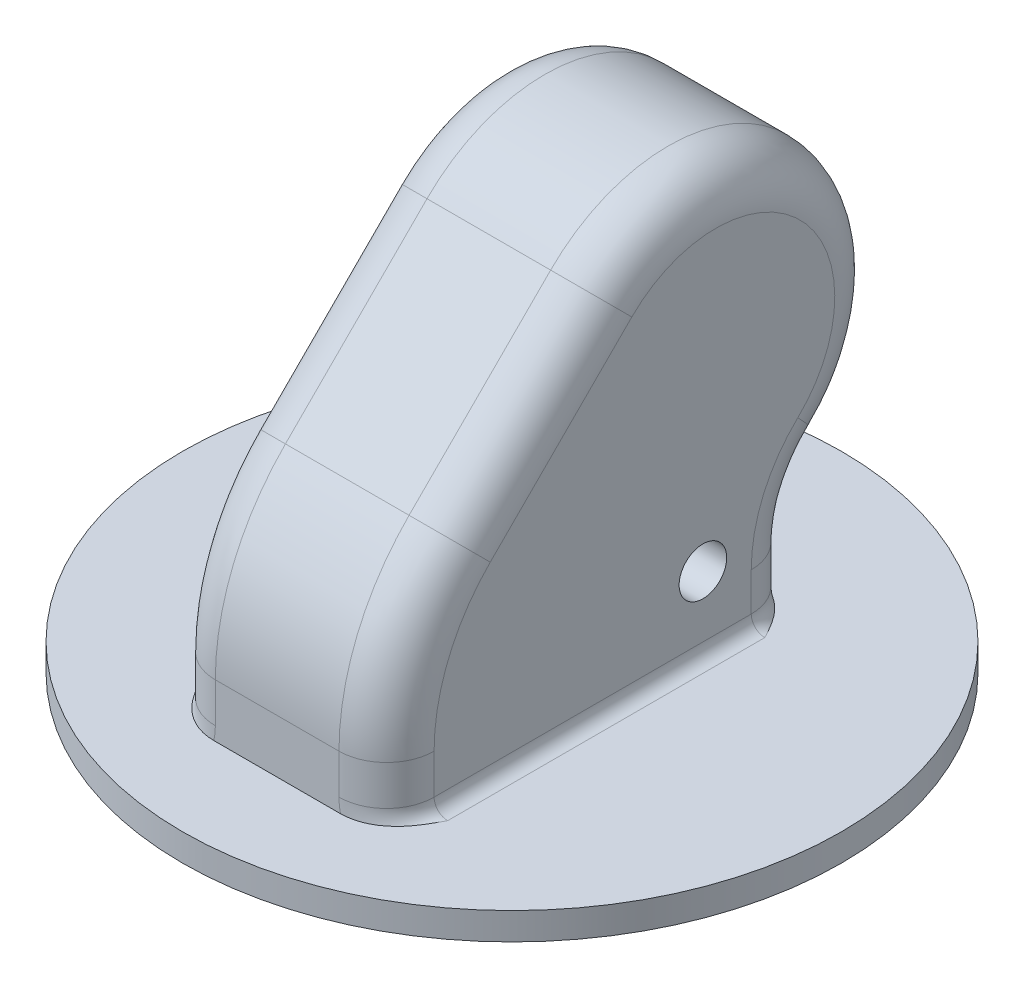
from build123d import *

# Parameters (mm, degrees)
SKETCH1_R           = 48.5
SKETCH1_R_2         = 1.5
BOSS_EXTRUDE1_DEPTH = 4
SKETCH2_R           = 3.75
CUT_EXTRUDE1_DEPTH  = 1.5
BOSS_EXTRUDE2_DEPTH = 16.1
CUT_EXTRUDE3_DEPTH  = 14.1
FILLET3_R           = 2
CUT_EXTRUDE4_DEPTH  = 10.1
CUT_EXTRUDE5_DEPTH  = 5
CUT_EXTRUDE6_REACH  = 105.546
SKETCH7_R           = 2.1
FILLET4_R           = 7
CUT_EXTRUDE7_REACH  = 96.345
CUT_EXTRUDE9_REACH  = 105.546
SKETCH10_R          = 3.5


with BuildPart() as part:
    # Sketch1 → Boss-Extrude1 (new body)
    with BuildSketch(Plane(origin=(0, 0, 0), x_dir=(1, 0, 0), z_dir=(0, 1, 0))):
        with Locations(Location((0, 0, 0), (0, 0, 270))):
            Circle(SKETCH1_R)
        with Locations(Location((0, 7.25, 0), (0, 0, 270))):
            Circle(SKETCH1_R_2, mode=Mode.SUBTRACT)
        with Locations(Location((0, -7.25, 0), (0, 0, 270))):
            Circle(SKETCH1_R_2, mode=Mode.SUBTRACT)
    extrude(amount=BOSS_EXTRUDE1_DEPTH)

    # Sketch2 → Cut-Extrude1 (cut)
    with BuildSketch(Plane.XZ):
        with Locations(Location((0, 0, 0), (0, 0, 270))):
            Circle(SKETCH2_R)
    extrude(amount=-CUT_EXTRUDE1_DEPTH, mode=Mode.SUBTRACT)

    # Sketch3 → Boss-Extrude2 (add)
    with BuildSketch(Plane(origin=(-16.1, 0, 0), x_dir=(0, 0, -1), z_dir=(1, 0, 0))):
        with BuildLine():
            Line((-34.56705163, 4), (-34.56705163, 11.86))
            ThreePointArc((-34.56705163, 11.86), (-31.885614823, 25.340493156), (-24.249528849, 36.768703429))
            Line((-24.249528849, 36.768703429), (-3.414116139, 57.604116139))
            ThreePointArc((-3.414116139, 57.604116139), (31.45553512, 57.379830331), (30.782714812, 22.515949367))
            ThreePointArc((30.782714812, 22.515949367), (27.329742948, 17.558044298), (26.11294837, 11.64))
            Line((26.11294837, 11.64), (26.11294837, 4))
            Line((26.11294837, 4), (-34.56705163, 4))
        make_face()
    extrude(amount=BOSS_EXTRUDE2_DEPTH)

    # Sketch4 → Cut-Extrude3 (cut)
    with BuildSketch(Plane(origin=(-14.1, 0, 0), x_dir=(0, 0, -1), z_dir=(1, 0, 0))):
        Polygon((13.741708053, 54.253843677), (27.883843677, 40.111708053), (-1.814641133, 10.413223243), (-15.956776757, 24.555358867), align=None)
    extrude(amount=CUT_EXTRUDE3_DEPTH, mode=Mode.SUBTRACT)

    # Fillet3
    fillet3_edges = [part.edges().sort_by_distance(p)[0] for p in [
        (-16.1, 4, 4.22705163),
    ]]
    fillet(fillet3_edges, radius=FILLET3_R)

    # Sketch5 → Cut-Extrude4 (cut)
    with BuildSketch(Plane(origin=(0, 0, 0), x_dir=(0, 0, -1), z_dir=(1, 0, 0))):
        with BuildLine():
            ThreePointArc((-1.292795796, 55.482795796), (-18.79687153, 31.790007), (-28.56705163, 4))
            Line((-28.56705163, 4), (-8.75, 4))
            Line((-8.75, 4), (-5.75, 4))
            Line((-5.75, 4), (5.75, 4))
            Line((5.75, 4), (8.75, 4))
            Line((8.75, 4), (23.11294837, 4))
            Line((23.11294837, 4), (23.11294837, 11.64))
            ThreePointArc((23.11294837, 11.64), (24.573101864, 18.741653158), (28.7166681, 24.691139241))
            ThreePointArc((28.7166681, 24.691139241), (29.307102248, 55.285973556), (-1.292795796, 55.482795796))
        make_face()
        Polygon((27.883843677, 40.111708053), (-1.814641133, 10.413223243), (-15.956776757, 24.555358867), (13.741708053, 54.253843677), align=None, mode=Mode.SUBTRACT)
    extrude(amount=-CUT_EXTRUDE4_DEPTH, mode=Mode.SUBTRACT)

    # Mirror6: part across plane


with BuildPart() as part_1:
    add(part.part)
    add(part.part.mirror(Plane(origin=(0, 11.64, -41.11294837), x_dir=(0, 0, 1), z_dir=(1, 0, 0))))

    # Sketch6 → Cut-Extrude5 (cut)
    with BuildSketch(Plane.ZY.offset(16.1)):
        Polygon((-27.883843677, 40.111708053), (1.814641133, 10.413223243), (15.956776757, 24.555358867), (-13.741708053, 54.253843677), align=None)
    extrude(amount=-CUT_EXTRUDE5_DEPTH, mode=Mode.SUBTRACT)

    # Sketch7 → Cut-Extrude6 (cut, up to next)
    with BuildSketch(Plane.ZY.offset(16.1), mode=Mode.PRIVATE) as cut_extrude6_sk1:
        with Locations((-20.706709848, 54.14777766)):
            Circle(SKETCH7_R)
    cut_extrude6_tool1 = extrude(cut_extrude6_sk1.sketch, amount=-CUT_EXTRUDE6_REACH, mode=Mode.PRIVATE) & part_1.part
    # Sketch7 → Cut-Extrude6 (cut, up to next)
    with BuildSketch(Plane.ZY.offset(16.1), mode=Mode.PRIVATE) as cut_extrude6_sk2:
        with Locations((-27.77777766, 47.076709848)):
            Circle(SKETCH7_R)
    cut_extrude6_tool2 = extrude(cut_extrude6_sk2.sketch, amount=-CUT_EXTRUDE6_REACH, mode=Mode.PRIVATE) & part_1.part
    # Sketch7 → Cut-Extrude6 (cut, up to next)
    with BuildSketch(Plane.ZY.offset(16.1), mode=Mode.PRIVATE) as cut_extrude6_sk3:
        with Locations((14.577918533, 18.863149278)):
            Circle(SKETCH7_R)
    cut_extrude6_tool3 = extrude(cut_extrude6_sk3.sketch, amount=-CUT_EXTRUDE6_REACH, mode=Mode.PRIVATE) & part_1.part
    # Sketch7 → Cut-Extrude6 (cut, up to next)
    with BuildSketch(Plane.ZY.offset(16.1), mode=Mode.PRIVATE) as cut_extrude6_sk4:
        with Locations((7.506850722, 11.792081467)):
            Circle(SKETCH7_R)
    cut_extrude6_tool4 = extrude(cut_extrude6_sk4.sketch, amount=-CUT_EXTRUDE6_REACH, mode=Mode.PRIVATE) & part_1.part
    add(cut_extrude6_tool1.solids().sort_by_distance((-16.1, 54.147778, -20.70671))[0], mode=Mode.SUBTRACT)
    add(cut_extrude6_tool2.solids().sort_by_distance((-16.1, 47.07671, -27.777778))[0], mode=Mode.SUBTRACT)
    add(cut_extrude6_tool3.solids().sort_by_distance((-16.1, 18.863149, 14.577919))[0], mode=Mode.SUBTRACT)
    add(cut_extrude6_tool4.solids().sort_by_distance((-16.1, 11.792081, 7.506851))[0], mode=Mode.SUBTRACT)

    # Fillet4
    # the kernel refuses this fillet: 7 mm, written as the material it takes off along each edge
    with BuildSketch(Plane(origin=(16.1, 11.64, -26.11294837), x_dir=(-1, 0, 0), z_dir=(0, -1, 0))) as fillet4_piece_1:
        with BuildLine():
            CenterArc((FILLET4_R, -FILLET4_R), FILLET4_R, 90, 90)
            Line((0, -FILLET4_R), (0, 0))
            Line((0, 0), (FILLET4_R, 0))
        make_face()
    extrude(amount=5.64, mode=Mode.SUBTRACT)
    with BuildSketch(Plane(origin=(16.1, 11.64, -41.11294837), x_dir=(0, 0.7250632911392403, 0.6886822372054715), z_dir=(0, 0.6886822372054715, -0.7250632911392403))) as fillet4_piece_2:
        with BuildLine():
            CenterArc((15 + FILLET4_R, -FILLET4_R), FILLET4_R, 90, 90)
            Line((15, -FILLET4_R), (15, 0))
            Line((15, 0), (15 + FILLET4_R, 0))
        make_face()
    revolve(axis=Axis((16.1, 11.64, -41.11294837), (1, 0, 0)), revolution_arc=46.474113163, mode=Mode.SUBTRACT)
    with BuildSketch(Plane(origin=(16.1, 40.28, -13.91), x_dir=(0, 0.7071067811865517, 0.7071067811865432), z_dir=(0, -0.7071067811865432, 0.7071067811865517))) as fillet4_piece_3:
        with BuildLine():
            CenterArc((24.5 - FILLET4_R, FILLET4_R), FILLET4_R, 270, 90)
            Line((24.5, FILLET4_R), (24.5, 0))
            Line((24.5, 0), (24.5 - FILLET4_R, 0))
        make_face()
    revolve(axis=Axis((16.1, 40.28, -13.91), (-1, 0, 0)), revolution_arc=181.474113163, mode=Mode.SUBTRACT)
    with BuildSketch(Plane(origin=(16.1, 36.768703429, 24.249528849), x_dir=(0, -0.707106781186551, -0.7071067811865439), z_dir=(0, 0.707106781186544, -0.707106781186551))) as fillet4_piece_4:
        with BuildLine():
            CenterArc((FILLET4_R, FILLET4_R), FILLET4_R, 180, 90)
            Line((0, FILLET4_R), (0, 0))
            Line((0, 0), (FILLET4_R, 0))
        make_face()
    extrude(amount=29.465723232, mode=Mode.SUBTRACT)
    with BuildSketch(Plane(origin=(16.1, 11.86, -0.65917458), x_dir=(0, 0, 1), z_dir=(0, -1, 0))) as fillet4_piece_5:
        with BuildLine():
            CenterArc((35.226226211 - FILLET4_R, FILLET4_R), FILLET4_R, 270, 90)
            Line((35.226226211, FILLET4_R), (35.226226211, 0))
            Line((35.226226211, 0), (35.226226211 - FILLET4_R, 0))
        make_face()
    revolve(axis=Axis((16.1, 11.86, -0.65917458), (-1, 0, 0)), revolution_arc=45, mode=Mode.SUBTRACT)
    with BuildSketch(Plane(origin=(16.1, 6, 34.56705163), x_dir=(-1, 0, 0), z_dir=(0, 1, 0))) as fillet4_piece_6:
        with BuildLine():
            CenterArc((FILLET4_R, -FILLET4_R), FILLET4_R, 90, 90)
            Line((0, -FILLET4_R), (0, 0))
            Line((0, 0), (FILLET4_R, 0))
        make_face()
    extrude(amount=5.86, mode=Mode.SUBTRACT)
    with BuildSketch(Plane(origin=(18.1, 6, 34.56705163), x_dir=(-0.9999802608561372, 0.006283143965558844, 0), z_dir=(-0.006283143965558844, -0.9999802608561372, 0))) as fillet4_piece_7_section:
        with BuildLine():
            CenterArc((2 + FILLET4_R, FILLET4_R), FILLET4_R, 180, 90)
            Line((2 + FILLET4_R, 0), (2, 0))
            Line((2, 0), (2, FILLET4_R))
        make_face()
    fillet4_piece_7 = revolve(axis=Axis((18.1, 6, 34.56705163), (0, 0, -1)), revolution_arc=359.64, mode=Mode.PRIVATE)
    fillet4_piece_7 = split(fillet4_piece_7, bisect_by=Plane(origin=(18.1, 4, 34.56705163), z_dir=(0, 1, 0)), keep=Keep.TOP, mode=Mode.PRIVATE)
    add(fillet4_piece_7, mode=Mode.SUBTRACT)
    with BuildSketch(Plane(origin=(18.1, 6, -26.11294837), x_dir=(-0.9999802608561372, 0.006283143965558844, 0), z_dir=(-0.006283143965558844, -0.9999802608561372, 0))) as fillet4_piece_8_section:
        with BuildLine():
            CenterArc((2 + FILLET4_R, -FILLET4_R), FILLET4_R, 90, 90)
            Line((2, -FILLET4_R), (2, 0))
            Line((2, 0), (2 + FILLET4_R, 0))
        make_face()
    fillet4_piece_8 = revolve(axis=Axis((18.1, 6, -26.11294837), (0, 0, -1)), revolution_arc=359.64, mode=Mode.PRIVATE)
    fillet4_piece_8 = split(fillet4_piece_8, bisect_by=Plane(origin=(18.1, 4, -26.11294837), z_dir=(0, 1, 0)), keep=Keep.TOP, mode=Mode.PRIVATE)
    add(fillet4_piece_8, mode=Mode.SUBTRACT)
    with BuildSketch(Plane(origin=(-16.1, 11.64, -41.11294837), x_dir=(0, 0.7250632911392403, 0.6886822372054715), z_dir=(0, 0.6886822372054715, -0.7250632911392403))) as fillet4_piece_9:
        with BuildLine():
            CenterArc((15 + FILLET4_R, FILLET4_R), FILLET4_R, 180, 90)
            Line((15, FILLET4_R), (15, 0))
            Line((15, 0), (15 + FILLET4_R, 0))
        make_face()
    revolve(axis=Axis((-16.1, 11.64, -41.11294837), (1, 0, 0)), revolution_arc=46.474113163, mode=Mode.SUBTRACT)
    with BuildSketch(Plane(origin=(-16.1, 40.28, -13.91), x_dir=(0, 0.7071067811865517, 0.7071067811865432), z_dir=(0, -0.7071067811865432, 0.7071067811865517))) as fillet4_piece_10:
        with BuildLine():
            CenterArc((24.5 - FILLET4_R, -FILLET4_R), FILLET4_R, 0, 90)
            Line((24.5, -FILLET4_R), (24.5, 0))
            Line((24.5, 0), (24.5 - FILLET4_R, 0))
        make_face()
    revolve(axis=Axis((-16.1, 40.28, -13.91), (-1, 0, 0)), revolution_arc=181.474113163, mode=Mode.SUBTRACT)
    with BuildSketch(Plane(origin=(-16.1, 36.768703429, 24.249528849), x_dir=(0, -0.707106781186551, -0.7071067811865439), z_dir=(0, 0.707106781186544, -0.707106781186551))) as fillet4_piece_11:
        with BuildLine():
            CenterArc((FILLET4_R, -FILLET4_R), FILLET4_R, 90, 90)
            Line((0, -FILLET4_R), (0, 0))
            Line((0, 0), (FILLET4_R, 0))
        make_face()
    extrude(amount=29.465723232, mode=Mode.SUBTRACT)
    with BuildSketch(Plane(origin=(-16.1, 11.86, -0.65917458), x_dir=(0, 0, 1), z_dir=(0, -1, 0))) as fillet4_piece_12:
        with BuildLine():
            CenterArc((35.226226211 - FILLET4_R, -FILLET4_R), FILLET4_R, 0, 90)
            Line((35.226226211, -FILLET4_R), (35.226226211, 0))
            Line((35.226226211, 0), (35.226226211 - FILLET4_R, 0))
        make_face()
    revolve(axis=Axis((-16.1, 11.86, -0.65917458), (-1, 0, 0)), revolution_arc=45, mode=Mode.SUBTRACT)
    with BuildSketch(Plane(origin=(-16.1, 6, 34.56705163), x_dir=(1, 0, 0), z_dir=(0, 1, 0))) as fillet4_piece_13:
        with BuildLine():
            CenterArc((FILLET4_R, FILLET4_R), FILLET4_R, 180, 90)
            Line((0, FILLET4_R), (0, 0))
            Line((0, 0), (FILLET4_R, 0))
        make_face()
    extrude(amount=5.86, mode=Mode.SUBTRACT)
    with BuildSketch(Plane(origin=(-16.1, 11.64, -26.11294837), x_dir=(1, 0, 0), z_dir=(0, -1, 0))) as fillet4_piece_14:
        with BuildLine():
            CenterArc((FILLET4_R, FILLET4_R), FILLET4_R, 180, 90)
            Line((0, FILLET4_R), (0, 0))
            Line((0, 0), (FILLET4_R, 0))
        make_face()
    extrude(amount=5.64, mode=Mode.SUBTRACT)
    with BuildSketch(Plane(origin=(-18.1, 6, -26.11294837), x_dir=(0.9999802608561372, 0.006283143965558844, 0), z_dir=(0.006283143965558844, -0.9999802608561372, 0))) as fillet4_piece_15_section:
        with BuildLine():
            CenterArc((2 + FILLET4_R, FILLET4_R), FILLET4_R, 180, 90)
            Line((2 + FILLET4_R, 0), (2, 0))
            Line((2, 0), (2, FILLET4_R))
        make_face()
    fillet4_piece_15 = revolve(axis=Axis((-18.1, 6, -26.11294837), (0, 0, 1)), revolution_arc=359.64, mode=Mode.PRIVATE)
    fillet4_piece_15 = split(fillet4_piece_15, bisect_by=Plane(origin=(-18.1, 4, -26.11294837), z_dir=(0, 1, 0)), keep=Keep.TOP, mode=Mode.PRIVATE)
    add(fillet4_piece_15, mode=Mode.SUBTRACT)
    with BuildSketch(Plane(origin=(-18.1, 6, 34.56705163), x_dir=(0.9999802608561372, 0.006283143965558844, 0), z_dir=(0.006283143965558844, -0.9999802608561372, 0))) as fillet4_piece_16_section:
        with BuildLine():
            CenterArc((2 + FILLET4_R, -FILLET4_R), FILLET4_R, 90, 90)
            Line((2 + FILLET4_R, 0), (2, 0))
            Line((2, 0), (2, -FILLET4_R))
        make_face()
    fillet4_piece_16 = revolve(axis=Axis((-18.1, 6, 34.56705163), (0, 0, 1)), revolution_arc=359.64, mode=Mode.PRIVATE)
    fillet4_piece_16 = split(fillet4_piece_16, bisect_by=Plane(origin=(-18.1, 4, 34.56705163), z_dir=(0, 1, 0)), keep=Keep.TOP, mode=Mode.PRIVATE)
    add(fillet4_piece_16, mode=Mode.SUBTRACT)

    # Sketch8 → Cut-Extrude7 (cut, up to next)
    with BuildSketch(Plane.XZ, mode=Mode.PRIVATE) as cut_extrude7_sk1:
        Polygon((3.510637207, 26.056023976), (-3.489352006, 26.068312993), (-6.999989213, 20.012289016), (-3.510637207, 13.943976024), (3.489352006, 13.931687007), (6.999989213, 19.987710984), align=None)
    cut_extrude7_tool1 = extrude(cut_extrude7_sk1.sketch, amount=-CUT_EXTRUDE7_REACH, mode=Mode.PRIVATE) & part_1.part
    add(cut_extrude7_tool1.solids().sort_by_distance((0, 0, 20))[0], mode=Mode.SUBTRACT)

    # Sketch10 → Cut-Extrude9 (cut, up to next)
    with BuildSketch(Plane(origin=(16.1, 0, 0), x_dir=(0, 0, -1), z_dir=(1, 0, 0)), mode=Mode.PRIVATE) as cut_extrude9_sk1:
        with Locations((12, 15)):
            Circle(SKETCH10_R)
    cut_extrude9_tool1 = extrude(cut_extrude9_sk1.sketch, amount=-CUT_EXTRUDE9_REACH, mode=Mode.PRIVATE) & part_1.part
    add(cut_extrude9_tool1.solids().sort_by_distance((16.1, 15, -12))[0], mode=Mode.SUBTRACT)


solid = part_1.part
